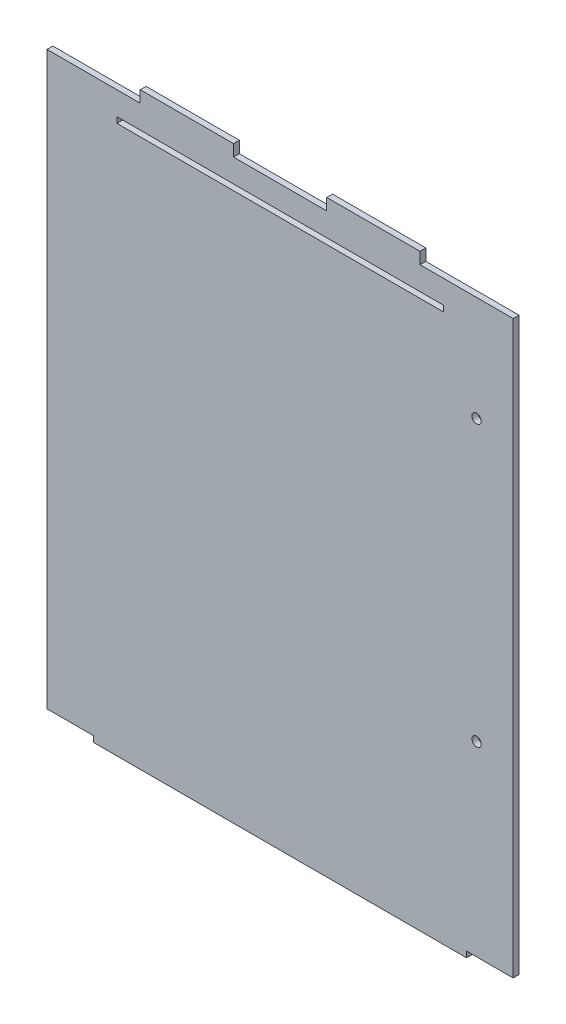
from build123d import *

# Parameters (mm, degrees)
SKETCH1_W           = 177.8
SKETCH1_H           = 3.175
BOSS_EXTRUDE1_DEPTH = 3.175
SKETCH2_R           = 2.54
CUT_EXTRUDE1_DEPTH  = 400.217586349


with BuildPart() as part:
    # Sketch1 → Boss-Extrude1 (new body)
    with BuildSketch(Plane.XY):
        Polygon((0, 301.625), (0, -9.525), (25.4, -9.525), (25.4, -12.7), (228.6, -12.7), (228.6, -9.525), (254, -9.525), (254, 301.625), (203.2, 301.625), (203.2, 307.975), (152.4, 307.975), (152.4, 301.625), (101.6, 301.625), (101.6, 307.975), (50.8, 307.975), (50.8, 301.625), align=None)
        with Locations((127, 287.3375)):
            Rectangle(SKETCH1_W, SKETCH1_H, mode=Mode.SUBTRACT)
    extrude(amount=BOSS_EXTRUDE1_DEPTH)

    # Sketch2 → Cut-Extrude1 (cut, through all)
    with BuildSketch(Plane(origin=(0, 0, 0), x_dir=(-1, 0, 0), z_dir=(0, 0, -1))):
        with Locations((-234.063292103, 244.475)):
            Circle(SKETCH2_R)
        with Locations((-234.063292103, 92.075)):
            Circle(SKETCH2_R)
    extrude(amount=-CUT_EXTRUDE1_DEPTH, mode=Mode.SUBTRACT)


solid = part.part
